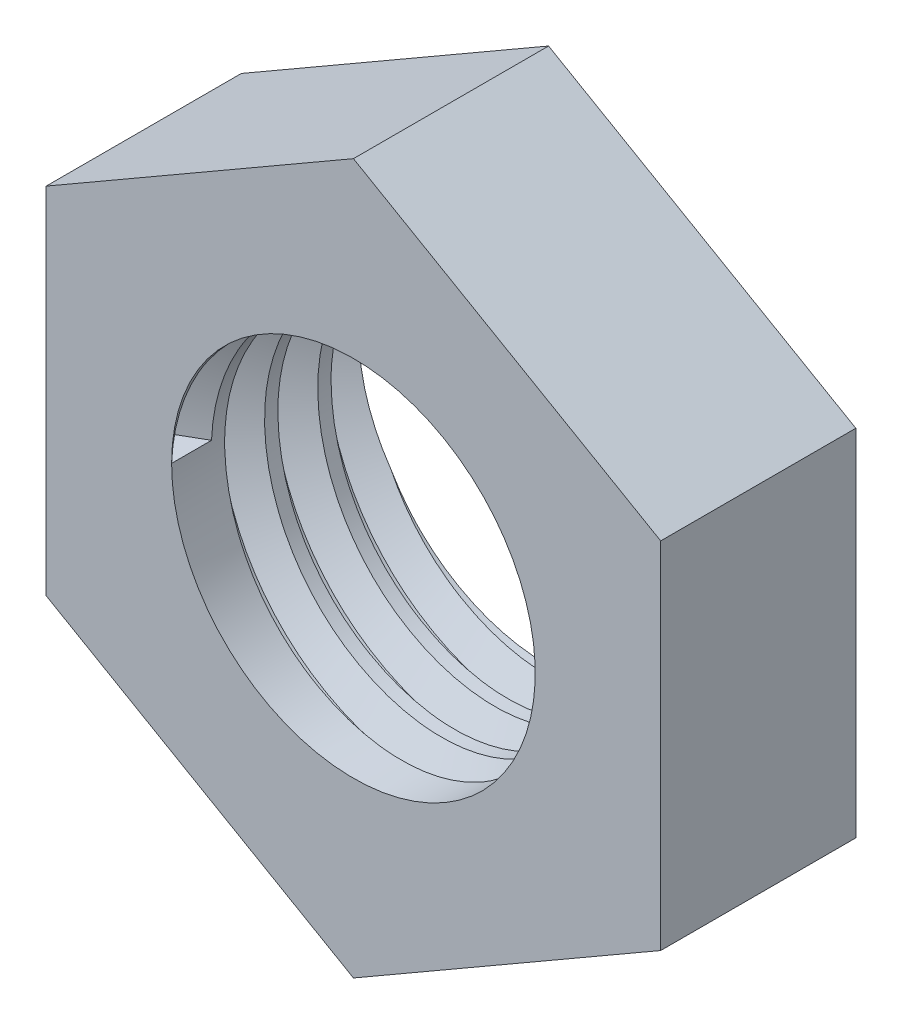
from build123d import *

# Parameters (mm, degrees)
SKETCH1_R           = 2.05
BOSS_EXTRUDE1_DEPTH = 2.2
THREAD1_PITCH       = 0.6


with BuildPart() as part:
    # Sketch1 → Boss-Extrude1 (new body)
    with BuildSketch(Plane.XY):
        Polygon((-3.464101615, -2), (0, -4), (3.464101615, -2), (3.464101615, 2), (0, 4), (-3.464101615, 2), align=None)
        Circle(SKETCH1_R, mode=Mode.SUBTRACT)
    extrude(amount=BOSS_EXTRUDE1_DEPTH)

    # Thread1: the profile of Thread Profile1 profile screwed along a right-hand helix of 3.666667 turns, 6 arcs to a turn; built about Z, then put on its axis
    thread1_z = Axis((0, 0, 0), (0, 0, 1))
    thread1_corners = [(2.0497, 0, -0.000173205), (2.374759525, 0, 0.187499999), (2.374759525, 0, 0.262499999), (2.0497, 0, 0.450173203)]
    with BuildLine(mode=Mode.PRIVATE) as thread1_profile:
        Line(thread1_corners[0], thread1_corners[1])
        Line(thread1_corners[1], thread1_corners[2])
        Line(thread1_corners[2], thread1_corners[3])
        Line(thread1_corners[3], thread1_corners[0])
    thread1_cap = Face(thread1_profile.wire())
    thread1_turn_angles = [0, 30, 60, 90, 120, 150, 180, 210, 240, 270, 300, 330, 360]
    thread1_turn_weights = [1, 0.8660254037844387, 1, 0.8660254037844387, 1, 0.8660254037844387, 1, 0.8660254037844387, 1, 0.8660254037844387, 1, 0.8660254037844387, 1]
    thread1_turn_rails = [Edge.make_bspline([Vector(p[0], p[1], 0).rotate(thread1_z, thread1_turn_angles[k]) / thread1_turn_weights[k] + Vector(0, 0, p[2] + THREAD1_PITCH * thread1_turn_angles[k] / 360) for k in range(13)], [0, 0, 0, 1, 1, 2, 2, 3, 3, 4, 4, 5, 5, 6, 6, 6], 2, thread1_turn_weights) for p in thread1_corners]
    thread1_turn_sides = [Face.make_surface_from_curves(thread1_turn_rails[p[0]], thread1_turn_rails[p[1]]) for p in [(0, 1), (1, 2), (2, 3), (3, 0)]]
    thread1_last_angles = [1080, 1110, 1140, 1170, 1200, 1230, 1260, 1290, 1320]
    thread1_last_weights = [1, 0.8660254037844387, 1, 0.8660254037844387, 1, 0.8660254037844387, 1, 0.8660254037844377, 1]
    thread1_last_rails = [Edge.make_bspline([Vector(p[0], p[1], 0).rotate(thread1_z, thread1_last_angles[k]) / thread1_last_weights[k] + Vector(0, 0, p[2] + THREAD1_PITCH * thread1_last_angles[k] / 360) for k in range(9)], [0, 0, 0, 1, 1, 2, 2, 3, 3, 4, 4, 4], 2, thread1_last_weights) for p in thread1_corners]
    thread1_last_sides = [Face.make_surface_from_curves(thread1_last_rails[p[0]], thread1_last_rails[p[1]]) for p in [(0, 1), (1, 2), (2, 3), (3, 0)]]
    thread1 = Plane(origin=(0, 0, 2.2), x_dir=(-1, 0, 0), z_dir=(0, 0, -1)) * Solid(Shell([*[p.moved(Location((0, 0, THREAD1_PITCH * i))) for i in range(3) for p in thread1_turn_sides], *thread1_last_sides, thread1_cap, thread1_cap.rotate(thread1_z, 1320).moved(Location((0, 0, THREAD1_PITCH * 1320 / 360)))]))
    add(thread1, mode=Mode.SUBTRACT)


solid = part.part
